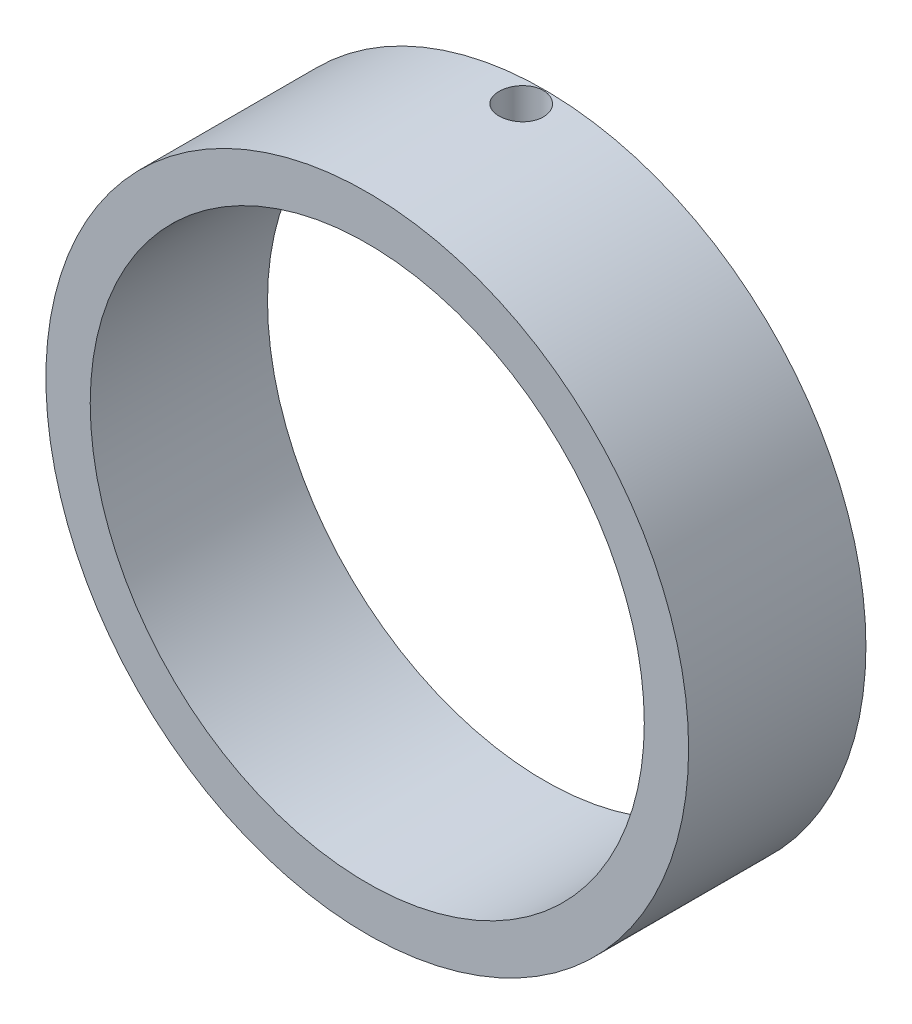
from build123d import *

# Parameters (mm, degrees)
SKETCH1_R           = 29
SKETCH1_R_2         = 25
BOSS_EXTRUDE1_DEPTH = 16
SKETCH3_R           = 2
CUT_EXTRUDE1_DEPTH  = 16


with BuildPart() as part:
    # Sketch1 → Boss-Extrude1 (new body)
    with BuildSketch(Plane.XY):
        Circle(SKETCH1_R)
        Circle(SKETCH1_R_2, mode=Mode.SUBTRACT)
    extrude(amount=BOSS_EXTRUDE1_DEPTH)

    # Sketch3 → Cut-Extrude1 (cut)
    with BuildSketch(Plane(origin=(0, 29, 0), x_dir=(1, 0, 0), z_dir=(0, 1, 0))):
        with Locations((0, -2.108912796)):
            Circle(SKETCH3_R)
    extrude(amount=-CUT_EXTRUDE1_DEPTH, mode=Mode.SUBTRACT)


solid = part.part
